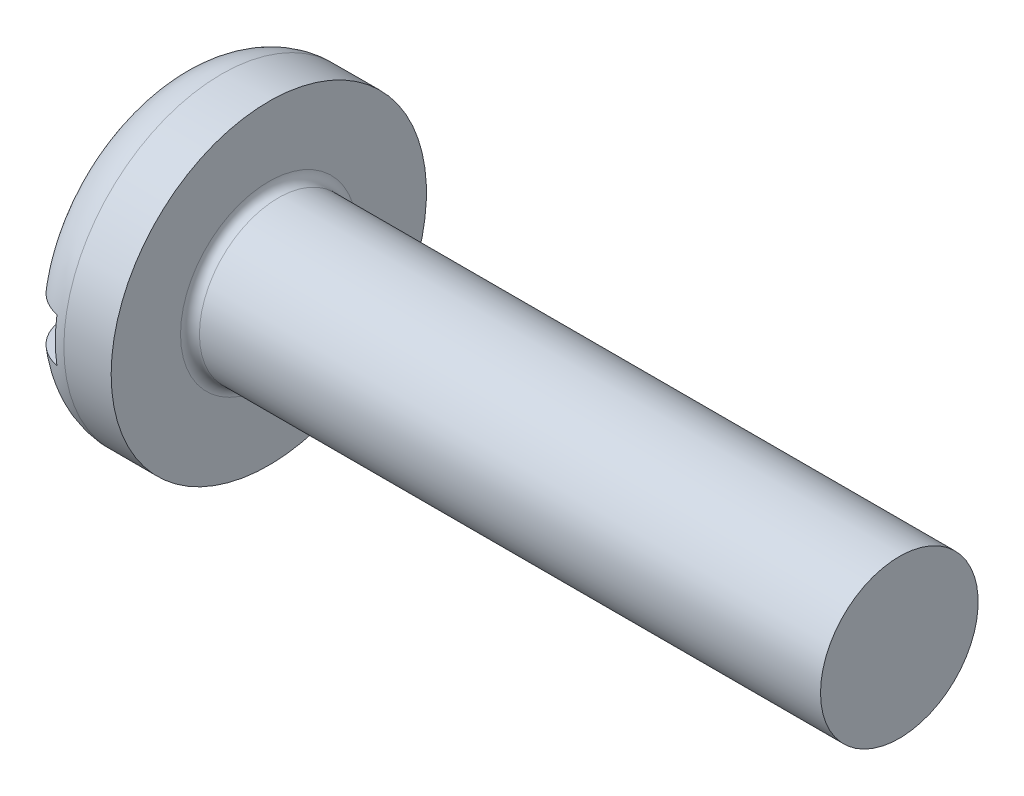
from build123d import *

# Parameters (mm, degrees)
FILLET_HEAD_R = 3
FILLET2_R     = 0.6
SLOTSKE_W     = 20
SLOTSKE_H     = 2.81
SLOT_DEPTH    = 2.4


with BuildPart() as part:
    # BodySke → BaseBody (revolve)
    with BuildSketch(Plane.XY):
        Polygon((0, 0), (0, 10), (6, 10), (6, 5), (46, 5), (46, 0), align=None)
    revolve(axis=Axis((0, 0, 0), (1, 0, 0)))

    # Fillet_head
    fillet_head_edges = [part.edges().sort_by_distance(p)[0] for p in [
        (0, -10, 0),
    ]]
    fillet(fillet_head_edges, radius=FILLET_HEAD_R)

    # Fillet2
    fillet2_edges = [part.edges().sort_by_distance(p)[0] for p in [
        (6, -5, 0),
    ]]
    fillet(fillet2_edges, radius=FILLET2_R)

    # SlotSke → Slot (cut)
    with BuildSketch(Plane.ZY):
        Rectangle(SLOTSKE_W, SLOTSKE_H)
    extrude(amount=-SLOT_DEPTH, mode=Mode.SUBTRACT)


solid = part.part
